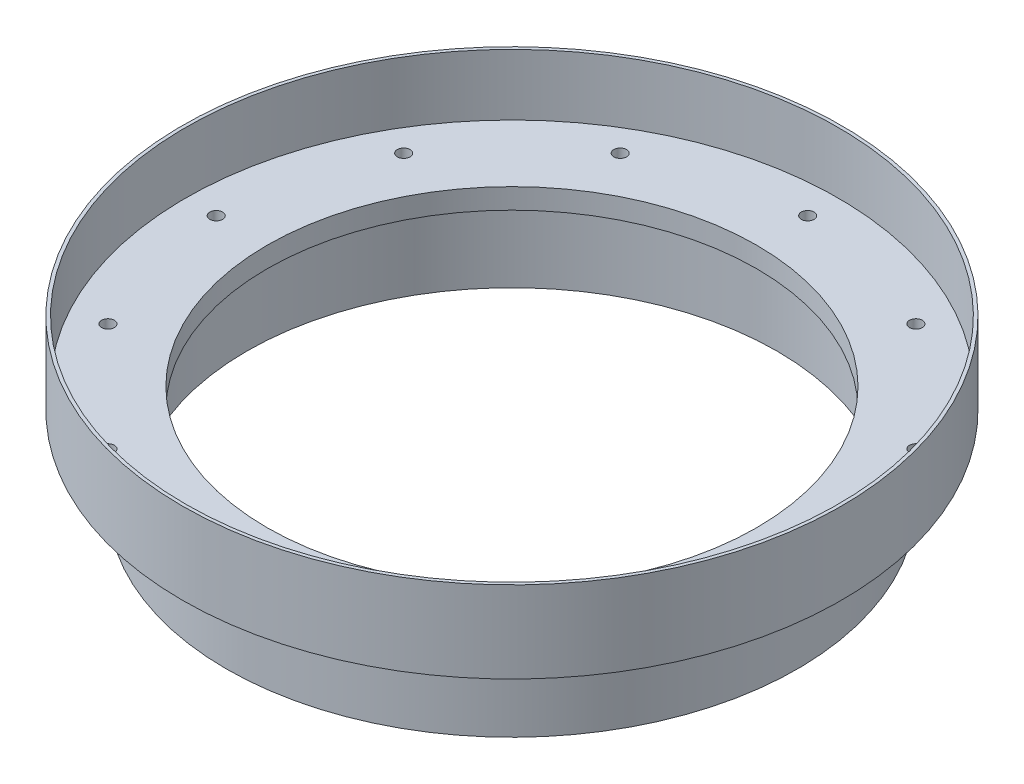
from build123d import *

# Parameters (mm, degrees)
SCREW_HOLES_COUNT = 12


with BuildPart() as part:
    # Cross Section → Main (revolve)
    with BuildSketch(Plane.XY):
        Polygon((-38.1, 0), (-38.1, -3.175), (-41.275, -3.175), (-41.275, -15.875), (-44.45, -15.875), (-44.45, -3.175), (-51.308, -3.175), (-51.308, 9.525), (-50.8, 9.525), (-50.8, 0), align=None)
    revolve(axis=Axis((0, 55, 0), (0, -1, 0)))

    # Sketch7 → #3-48 Tapped Hole1 (revolve, cut)
    with BuildSketch(Plane(origin=(-46.0375, 0, 0), x_dir=(0, 0, 1), z_dir=(1, 0, 0))):
        Polygon((0, 0), (0, 3.901027994), (0.99695, 3.302), (0.99695, 0), align=None)
    f_3_48_tapped_hole1 = revolve(axis=Axis((-46.0375, 6.35, 0), (0, -1, 0)), mode=Mode.SUBTRACT)

    # Screw Holes: #3-48 Tapped Hole1 ×12 about axis
    screw_holes_axis = Axis((0, 55, 0), (0, -1, 0))
    for i in range(1, SCREW_HOLES_COUNT):
        add(f_3_48_tapped_hole1.rotate(screw_holes_axis, i * 360 / SCREW_HOLES_COUNT), mode=Mode.SUBTRACT)


solid = part.part
